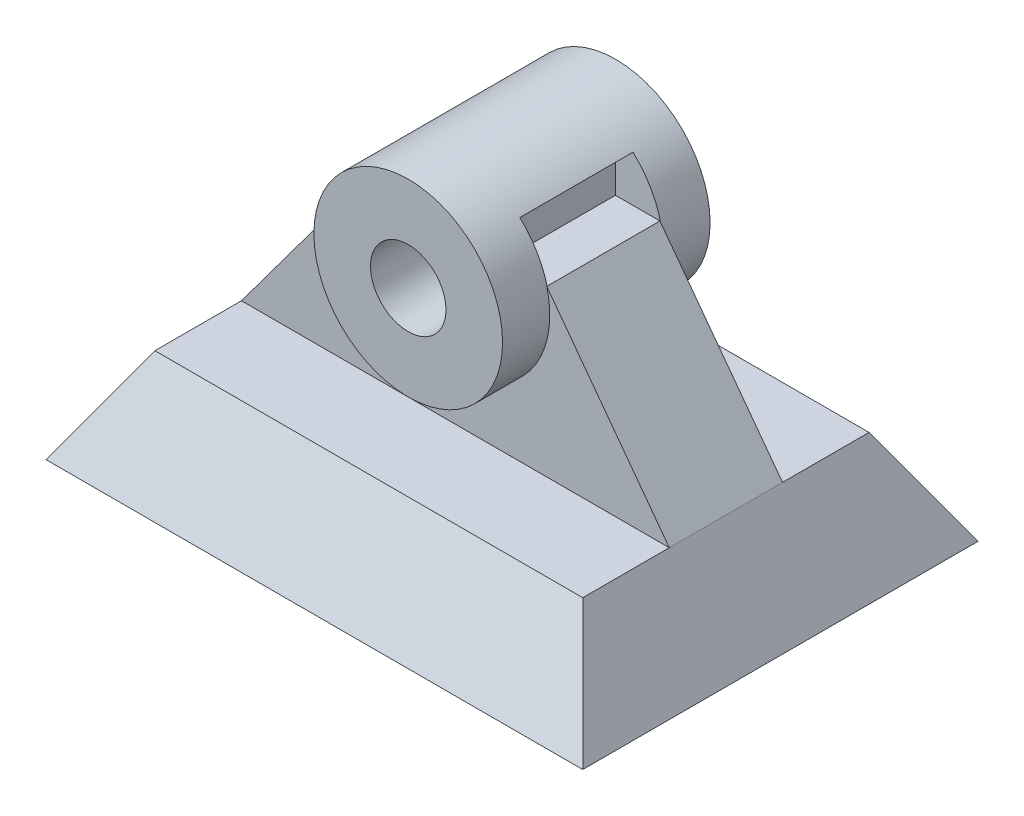
from build123d import *
from build123d.topology import SkipClean

# Parameters (mm, degrees)
SKETCH1_W           = 90
SKETCH1_H           = 20
BOSS_EXTRUDE1_DEPTH = 60
DRAFT3_ANGLE        = 1
DRAFT4_ANGLE        = 30
SKETCH4_R           = 20
BOSS_EXTRUDE2_DEPTH = 22
SKETCH5_R           = 8
CUT_EXTRUDE1_DEPTH  = 44
SKETCH6_W           = 24
SKETCH6_H           = 26.093760725
CUT_EXTRUDE2_DEPTH  = 22
BOSS_EXTRUDE4_DEPTH = 12
SKETCH10_R          = 8
CUT_EXTRUDE3_DEPTH  = 112.54956216
BOSS_EXTRUDE7_DEPTH = 10
CUT_EXTRUDE4_DEPTH  = 112.54956216


with BuildPart() as part:
    # Sketch1 → Boss-Extrude1 (new body)
    with BuildSketch(Plane.XY):
        with Locations((-1.930693069, 10)):
            Rectangle(SKETCH1_W, SKETCH1_H)
    extrude(amount=-BOSS_EXTRUDE1_DEPTH)

    # Draft3
    draft3_faces = [part.faces().sort_by_distance(p)[0] for p in [
        (-46.930693069, 10, -30),
        (-1.930693069, 10, -60),
        (43.069306931, 10, -30),
        (-1.930693069, 10, 0),
    ]]
    draft(draft3_faces, Plane(origin=(43.069306931, 0, -60), x_dir=(0, 0, -1), z_dir=(0, -1, 0)), DRAFT3_ANGLE)

    # Draft4
    draft4_faces = [part.faces().sort_by_distance(p)[0] for p in [
        (-1.930693069, 10.012879719, -60.174775466),
        (43.244194154, 10.019282325, -30),
        (-47.105580293, 10.019282325, -30),
        (-1.930693069, 10.012879719, 0.174775466),
    ]]
    draft(draft4_faces, Plane(origin=(-46.930693069, 20, -60), x_dir=(0, 0, 1), z_dir=(0, 1, 0)), DRAFT4_ANGLE)



with BuildPart() as body_2:
    # Sketch4 → Boss-Extrude2 (new, symmetric)
    with BuildSketch(Plane.XY.offset(-30)):
        with Locations((-1.930693069, 50)):
            Circle(SKETCH4_R)
    extrude(amount=BOSS_EXTRUDE2_DEPTH, both=True)

    # Sketch5 → Cut-Extrude1 (cut)
    with BuildSketch(Plane.XY.offset(-8)):
        with Locations((-1.930693069, 50)):
            Circle(SKETCH5_R)
    extrude(amount=-CUT_EXTRUDE1_DEPTH, mode=Mode.SUBTRACT)

    # Sketch6 → Cut-Extrude2 (cut, symmetric)
    with BuildSketch(Plane(origin=(0, 0, 0), x_dir=(0, 0, -1), z_dir=(1, 0, 0))):
        with Locations((30.080627817, 51.644168364)):
            Rectangle(SKETCH6_W, SKETCH6_H)
    extrude(amount=CUT_EXTRUDE2_DEPTH, both=True, mode=Mode.SUBTRACT)


with BuildPart() as part_1:
    add(part.part)

    add(body_2.part)  # Boss-Extrude4 merges body 2
    # Sketch7 → Boss-Extrude4 (add, symmetric)
    with BuildSketch(Plane.XY.offset(-30)):
        Polygon((43.418408229, 20), (-47.279794368, 20), (-21.2956098, 55), (17.434223662, 55), align=None)
    extrude(amount=BOSS_EXTRUDE4_DEPTH, both=True)

    # Sketch10 → Cut-Extrude3 (cut, through all)
    with SkipClean():  # the faces are left unmerged after this step: merging them gives an invalid solid
        with BuildSketch(Plane(origin=(0, 0, -52), x_dir=(-1, 0, 0), z_dir=(0, 0, -1))):
            with Locations((1.930693069, 50)):
                Circle(SKETCH10_R)
        extrude(amount=-CUT_EXTRUDE3_DEPTH, mode=Mode.SUBTRACT)

    # Sketch13 → Boss-Extrude7 (add, symmetric)
    with BuildSketch(Plane(origin=(-2, 0, 0), x_dir=(0, 0, -1), z_dir=(1, 0, 0))):
        Polygon((18.080627817, 55), (18.080627817, 64.691048726), (42.080627817, 64.691048726), (42, 55), align=None)
    extrude(amount=BOSS_EXTRUDE7_DEPTH, both=True)

    # Sketch14 → Cut-Extrude4 (cut, through all)
    with BuildSketch(Plane.XY.offset(-8)):
        with BuildLine():
            Line((-8.175691068, 55), (4.314304929, 55))
            ThreePointArc((4.314304929, 55), (-1.930693069, 58), (-8.175691068, 55))
        make_face()
    extrude(amount=-CUT_EXTRUDE4_DEPTH, mode=Mode.SUBTRACT)


solid = part_1.part
